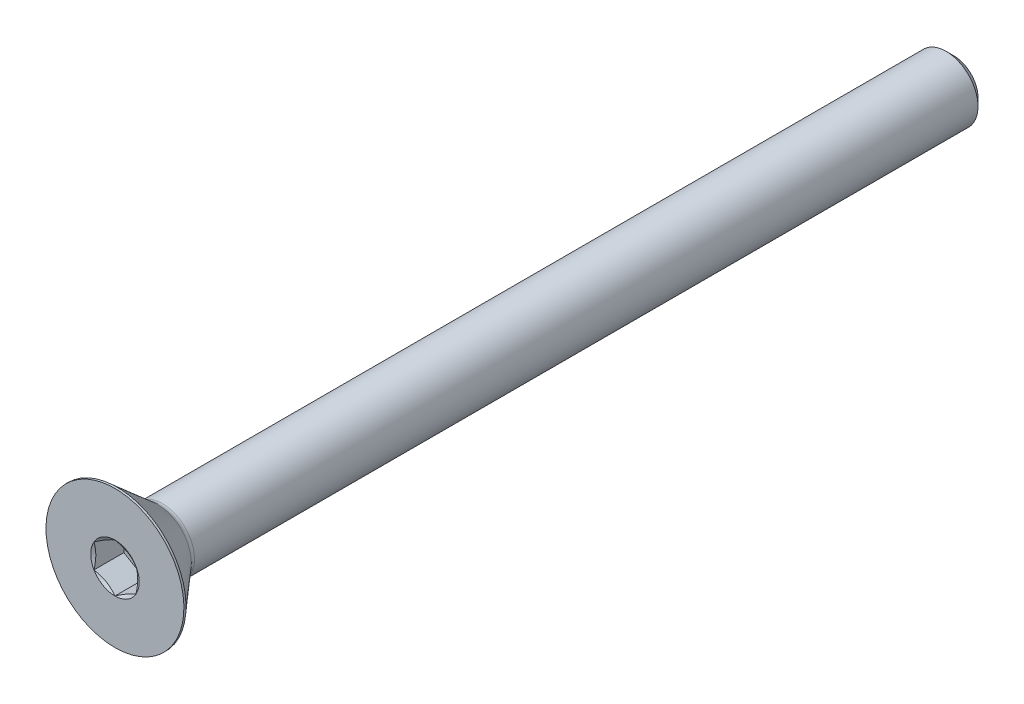
from build123d import *

# Parameters (mm, degrees)
SKETCH1_W          = 63.5
SKETCH1_H          = 2.413
CHAMFER1_SIZE      = 0.5953125
CUT_EXTRUDE2_DEPTH = 2.25806


with BuildPart() as part:
    # Sketch1 → Revolve1 (revolve)
    with BuildSketch(Plane(origin=(0, 0, 0), x_dir=(0, 0, -1), z_dir=(1, 0, 0))):
        with Locations((31.75, 1.2065)):
            Rectangle(SKETCH1_W, SKETCH1_H)
    revolve(axis=Axis((0, 0, -63.5), (0, 0, 1)))

    # Chamfer1
    chamfer1_edges = [part.edges().sort_by_distance(p)[0] for p in [
        (0, -2.413, -63.5),
    ]]
    chamfer(chamfer1_edges, length=CHAMFER1_SIZE)

    # Sketch7 → Revolve2 (revolve)
    with BuildSketch(Plane(origin=(0, 0, 0), x_dir=(0, 0, -1), z_dir=(1, 0, 0))):
        with BuildLine():
            Line((0, 5.2197), (0.16129, 5.2197))
            Line((0.16129, 5.2197), (3.2258, 2.555762099))
            ThreePointArc((3.2258, 2.555762099), (3.403809493, 2.44985758), (3.607634579, 2.413))
            Line((3.607634579, 2.413), (3.607634579, 0))
            Line((3.607634579, 0), (0, 0))
            Line((0, 0), (0, 5.2197))
        make_face()
    revolve(axis=Axis((0, 0, 0), (0, 0, -1)))

    # Sketch5 → Cut-Extrude2 (cut)
    with BuildSketch(Plane.XY):
        Polygon((0, 1.833087105), (-1.5875, 0.916543552), (-1.5875, -0.916543552), (0, -1.833087105), (1.5875, -0.916543552), (1.5875, 0.916543552), align=None)
    extrude(amount=-CUT_EXTRUDE2_DEPTH, mode=Mode.SUBTRACT)

    # Cut-Extrude3 cone 1 section (through the dimple's axis) → Cut-Extrude3 (revolve, cut)
    with BuildSketch(Plane(origin=(0, 0, 0), x_dir=(0, -1, 0), z_dir=(1, 0, 0))):
        Polygon((0, 0), (1.833087105, 0), (0, 1.058333333), align=None)
    revolve(axis=Axis((0, 0, 0), (0, 0, -1)), mode=Mode.SUBTRACT)


solid = part.part
